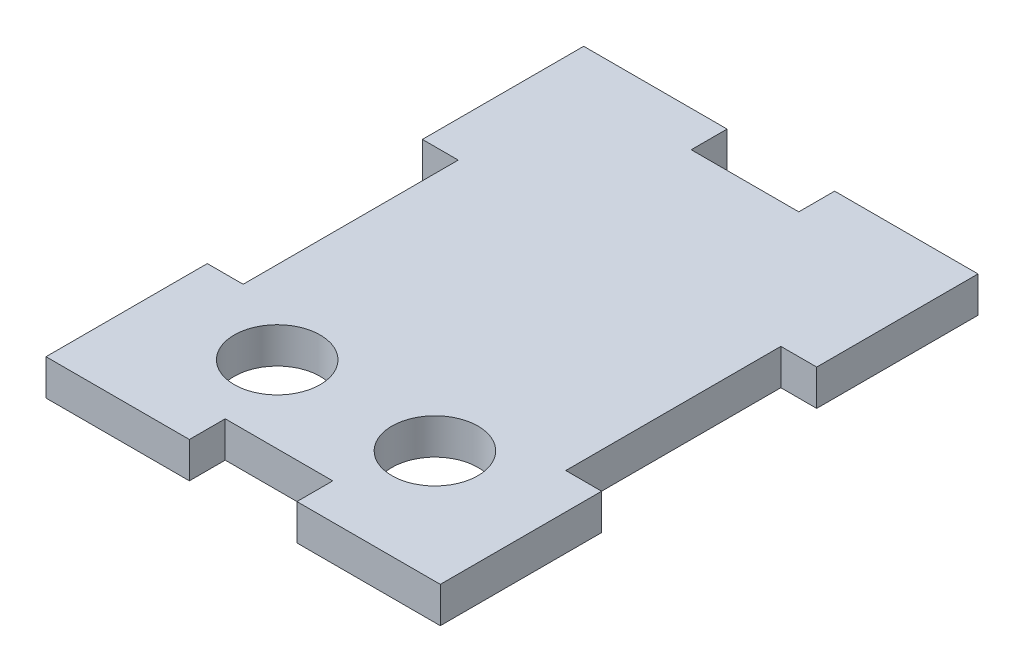
from build123d import *

# Parameters (mm, degrees)
SKETCH1_W               = 55
SKETCH1_H               = 75
BOSS_EXTRUDE1_DEPTH     = 5
CUT_EXTRUDE3_DEPTH      = 94.139680051
CUT_EXTRUDE3_DEPTH_BACK = 94.139680051
SKETCH5_W               = 5
SKETCH5_H               = 30
SKETCH5_W_2             = 15
SKETCH5_H_2             = 5
SKETCH6_W               = 43.5
SKETCH6_H               = 43.5
CUT_EXTRUDE4_DEPTH      = 2.5
SKETCH7_R               = 6
CUT_EXTRUDE5_DEPTH      = 94.139680051


with BuildPart() as part:
    # Sketch1 → Boss-Extrude1 (new body)
    with BuildSketch(Plane(origin=(0, 0, 0), x_dir=(1, 0, 0), z_dir=(0, 1, 0))):
        with Locations((27.5, 37.5)):
            Rectangle(SKETCH1_W, SKETCH1_H)
    extrude(amount=BOSS_EXTRUDE1_DEPTH)

    # Sketch5 → Cut-Extrude3 (cut, two sides: drawn at the far end of the back side and taken through both)
    with BuildSketch(Plane(origin=(0, 5, 0), x_dir=(1, 0, 0), z_dir=(0, 1, 0)).offset(-CUT_EXTRUDE3_DEPTH_BACK)):
        with Locations((2.5, 37.5)):
            Rectangle(SKETCH5_W, SKETCH5_H)
        with Locations((27.5, 72.5)):
            Rectangle(SKETCH5_W_2, SKETCH5_H_2)
        with Locations((52.5, 37.5)):
            Rectangle(SKETCH5_W, SKETCH5_H)
        with Locations((27.5, 2.5)):
            Rectangle(SKETCH5_W_2, SKETCH5_H_2)
    extrude(amount=CUT_EXTRUDE3_DEPTH + CUT_EXTRUDE3_DEPTH_BACK, mode=Mode.SUBTRACT)

    # Sketch6 → Cut-Extrude4 (cut)
    with BuildSketch(Plane.XZ):
        with Locations((27.5, -48.25)):
            Rectangle(SKETCH6_W, SKETCH6_H)
    extrude(amount=-CUT_EXTRUDE4_DEPTH, mode=Mode.SUBTRACT)

    # Sketch7 → Cut-Extrude5 (cut, through all)
    with BuildSketch(Plane(origin=(0, 5, 0), x_dir=(1, 0, 0), z_dir=(0, 1, 0))):
        with Locations((16.5, 15.75)):
            Circle(SKETCH7_R)
        with Locations((38.5, 15.75)):
            Circle(SKETCH7_R)
    extrude(amount=-CUT_EXTRUDE5_DEPTH, mode=Mode.SUBTRACT)


solid = part.part
